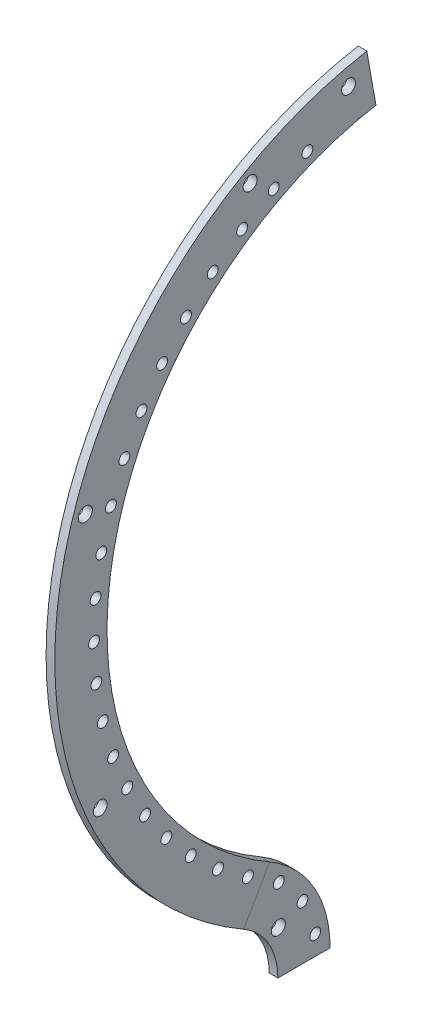
from build123d import *

# Parameters (mm, degrees)
SKETCH2_W             = 2
SKETCH2_H             = 12
CUT_EXTRUDE1_DEPTH    = 10
SKETCH4_R             = 1.25
CUT_EXTRUDE2_DEPTH    = 10
CRVPATTERN2_OUTLINE_R = 1.25
CRVPATTERN2_DEPTH     = 2
SKETCH7_R             = 1.6
CUT_EXTRUDE3_DEPTH    = 2
SKETCH8_R             = 1.6
CUT_EXTRUDE4_DEPTH    = 11


# Read off the part's stored shape, not the designer's step: CrvPattern2
with BuildPart() as part:
    # Sweep1: sweep along a path in Sketch1
    with BuildLine(Plane(origin=(0, 0, 0), x_dir=(0, 0, -1), z_dir=(1, 0, 0))) as sweep1_path:
        ThreePointArc((0, 163.5), (-72.196731601, 108.101499399), (-37.371778265, 24.026624746))
        ThreePointArc((-37.371778265, 24.026624746), (-27.216931784, 13.871778265), (-23.5, 0))
    # Sketch2 → Sweep1 (sweep)
    with BuildSketch(Plane(origin=(0, 0, 0), x_dir=(1, 0, 0), z_dir=(0, 1, 0))):
        with Locations((1, -29.5)):
            Rectangle(SKETCH2_W, SKETCH2_H)
    sweep(path=sweep1_path.line)

    # Sketch3 → Cut-Extrude1 (cut)
    with BuildSketch(Plane(origin=(2, 0, 0), x_dir=(0, 0, -1), z_dir=(1, 0, 0))):
        with BuildLine():
            Line((0, 88.75644347), (-15.062860516, 174.182170465))
            ThreePointArc((-15.062860516, 174.182170465), (-7.560199098, 175.169914579), (0, 175.5))
            Line((0, 175.5), (0, 88.75644347))
        make_face()
    extrude(amount=-CUT_EXTRUDE1_DEPTH, mode=Mode.SUBTRACT)

    # Sketch4 → Cut-Extrude2 (cut)
    with BuildSketch(Plane.ZY):
        with Locations((26.912638139, 4.5)):
            Circle(SKETCH4_R)
    extrude(amount=-CUT_EXTRUDE2_DEPTH, mode=Mode.SUBTRACT)

    # CrvPattern2 outline → CrvPattern2 (cut)
    with BuildSketch(Plane.YZ):
        with Locations((18.911112769, 35.286946502)):
            Circle(CRVPATTERN2_OUTLINE_R)
        with Locations((12.43190695, 29.849835971)):
            Circle(CRVPATTERN2_OUTLINE_R)
        with Locations((161.000106646, 28.721311128)):
            Circle(CRVPATTERN2_OUTLINE_R)
        with Locations((157.434782313, 36.432764864)):
            Circle(CRVPATTERN2_OUTLINE_R)
        with Locations((153.049302567, 43.709139217)):
            Circle(CRVPATTERN2_OUTLINE_R)
        with Locations((147.896038722, 50.463539862)):
            Circle(CRVPATTERN2_OUTLINE_R)
        with Locations((142.036530957, 56.615305875)):
            Circle(CRVPATTERN2_OUTLINE_R)
        with Locations((135.540753402, 62.090972984)):
            Circle(CRVPATTERN2_OUTLINE_R)
        with Locations((128.486278509, 66.825150876)):
            Circle(CRVPATTERN2_OUTLINE_R)
        with Locations((120.957350684, 70.76130409)):
            Circle(CRVPATTERN2_OUTLINE_R)
        with Locations((113.043880237, 73.852427158)):
            Circle(CRVPATTERN2_OUTLINE_R)
        with Locations((104.840369684, 76.061605948)):
            Circle(CRVPATTERN2_OUTLINE_R)
        with Locations((96.44478519, 77.362458489)):
            Circle(CRVPATTERN2_OUTLINE_R)
        with Locations((87.957386665, 77.739450025)):
            Circle(CRVPATTERN2_OUTLINE_R)
        with Locations((79.479530462, 77.188078529)):
            Circle(CRVPATTERN2_OUTLINE_R)
        with Locations((71.112458978, 75.714928469)):
            Circle(CRVPATTERN2_OUTLINE_R)
        with Locations((62.956091619, 73.337592177)):
            Circle(CRVPATTERN2_OUTLINE_R)
        with Locations((55.107831572, 70.084459755)):
            Circle(CRVPATTERN2_OUTLINE_R)
        with Locations((47.661402606, 65.994380051)):
            Circle(CRVPATTERN2_OUTLINE_R)
        with Locations((40.705729836, 61.116196717)):
            Circle(CRVPATTERN2_OUTLINE_R)
        with Locations((34.323877772, 55.508164926)):
            Circle(CRVPATTERN2_OUTLINE_R)
        with Locations((28.592058371, 49.237255687)):
            Circle(CRVPATTERN2_OUTLINE_R)
        with Locations((23.578720911, 42.378356079)):
            Circle(CRVPATTERN2_OUTLINE_R)
    extrude(amount=CRVPATTERN2_DEPTH, mode=Mode.SUBTRACT)

    # Sketch7 → Cut-Extrude3 (cut)
    with BuildSketch(Plane.ZY):
        with Locations((35.390452374, 10)):
            Circle(SKETCH7_R)
        with Locations((76.299174561, 54.239502389)):
            Circle(SKETCH7_R)
        with Locations((79.721620809, 114.397161787)):
            Circle(SKETCH7_R)
        with Locations((41.871778265, 161.280490828)):
            Circle(SKETCH7_R)
    extrude(amount=-CUT_EXTRUDE3_DEPTH, mode=Mode.SUBTRACT)

    # Sketch8 → Cut-Extrude4 (cut)
    with BuildSketch(Plane(origin=(2, 0, 0), x_dir=(0, 0, -1), z_dir=(1, 0, 0))):
        with Locations((-19.266049694, 169.225788418)):
            Circle(SKETCH8_R)
    extrude(amount=-CUT_EXTRUDE4_DEPTH, mode=Mode.SUBTRACT)


solid = part.part
